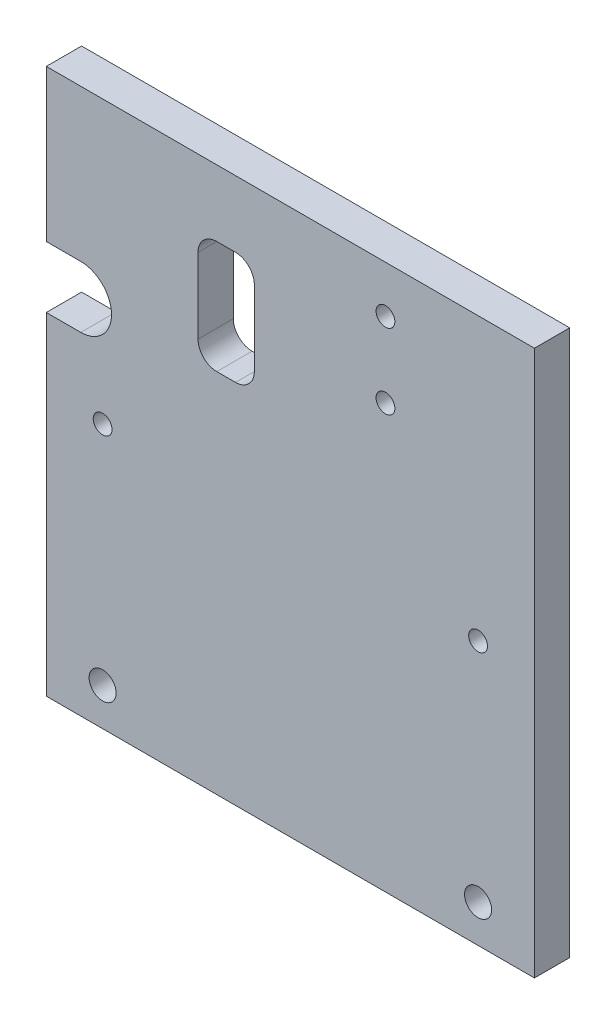
from build123d import *

# Parameters (mm, degrees)
SKETCH1_W           = 130
SKETCH1_H           = 145.26
SKETCH1_R           = 3.6
SKETCH1_R_2         = 2.5
BOSS_EXTRUDE1_DEPTH = 9.4
SKETCH2_R           = 2.5
CUT_EXTRUDE1_DEPTH  = 178.788153711
CUT_EXTRUDE2_DEPTH  = 178.788153711
CUT_EXTRUDE3_DEPTH  = 178.788153711


with BuildPart() as part:
    # Sketch1 → Boss-Extrude1 (new body)
    with BuildSketch(Plane.XY):
        with Locations((50, 62.63)):
            Rectangle(SKETCH1_W, SKETCH1_H)
        Circle(SKETCH1_R, mode=Mode.SUBTRACT)
        with Locations((0, 60.26)):
            Circle(SKETCH1_R_2, mode=Mode.SUBTRACT)
        with Locations((100, 60.26)):
            Circle(SKETCH1_R_2, mode=Mode.SUBTRACT)
        with Locations((100, 0)):
            Circle(SKETCH1_R, mode=Mode.SUBTRACT)
    extrude(amount=BOSS_EXTRUDE1_DEPTH)

    # Sketch2 → Cut-Extrude1 (cut, through all)
    with BuildSketch(Plane.XY.offset(9.4)):
        with Locations((75.33, 122.766411568)):
            Circle(SKETCH2_R)
        with Locations((75.33, 102.766411568)):
            Circle(SKETCH2_R)
    extrude(amount=-CUT_EXTRUDE1_DEPTH, mode=Mode.SUBTRACT)

    # Sketch3 → Cut-Extrude2 (cut, through all)
    with BuildSketch(Plane(origin=(0, 0, 0), x_dir=(-1, 0, 0), z_dir=(0, 0, -1))):
        with BuildLine():
            Line((-35.40754614, 117.570367495), (-30.40754614, 117.570367495))
            ThreePointArc((-30.40754614, 117.570367495), (-26.872012234, 116.105901401), (-25.40754614, 112.570367495))
            Line((-25.40754614, 112.570367495), (-25.40754614, 92.570367495))
            ThreePointArc((-25.40754614, 92.570367495), (-26.872012234, 89.034833589), (-30.40754614, 87.570367495))
            Line((-30.40754614, 87.570367495), (-35.40754614, 87.570367495))
            ThreePointArc((-35.40754614, 87.570367495), (-38.943080046, 89.034833589), (-40.40754614, 92.570367495))
            Line((-40.40754614, 92.570367495), (-40.40754614, 112.570367495))
            ThreePointArc((-40.40754614, 112.570367495), (-38.943080046, 116.105901401), (-35.40754614, 117.570367495))
        make_face()
    extrude(amount=-CUT_EXTRUDE2_DEPTH, mode=Mode.SUBTRACT)

    # Sketch4 → Cut-Extrude3 (cut, through all)
    with BuildSketch(Plane.XY.offset(9.4)):
        with BuildLine():
            Line((-15, 78.5), (-15, 94.86))
            Line((-15, 94.86), (-5.81, 94.86))
            ThreePointArc((-5.81, 94.86), (2.37, 86.68), (-5.81, 78.5))
            Line((-5.81, 78.5), (-15, 78.5))
        make_face()
    extrude(amount=-CUT_EXTRUDE3_DEPTH, mode=Mode.SUBTRACT)


solid = part.part
